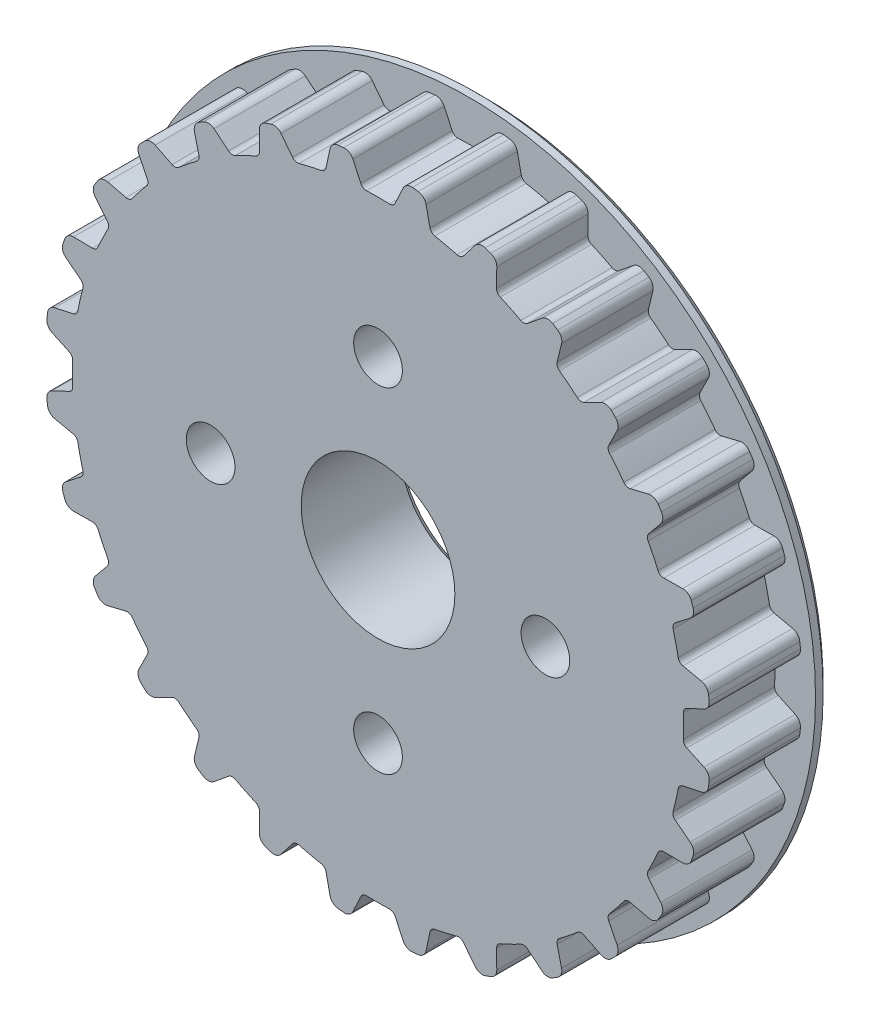
from build123d import *

# Parameters (mm, degrees)
EXTRUDE_1_DEPTH          = 6
PATTERN_CIRCULAR_1_COUNT = 28
SKETCH_4_R               = 22.75
EXTRUDE_2_DEPTH          = 1
SKETCH_2_R               = 5.05
CUT_EXTRUDE_1_DEPTH      = 33.926053514
SKETCH_3_R               = 1.6
CUT_EXTRUDE_2_DEPTH      = 33.926053514
CHAMFER_1_SIZE           = 2
CHAMFER_2_SIZE           = 0.5


with BuildPart() as part:
    # ｽｹｯﾁ1 → ﾎﾞｽ - 押し出し1 (new body)
    with BuildSketch(Plane.XY):
        with BuildLine():
            Line((-1.127467075, 20.291658591), (-1.651302325, 21.415026911))
            ThreePointArc((-1.651302325, 21.415026911), (-1.89927809, 21.683468492), (-2.256993094, 21.758253771))
            ThreePointArc((-2.256993094, 21.758253771), (-2.353130985, 21.748066571), (-2.449222915, 21.737454591))
            Line((-2.449222915, 21.737454591), (-0.559822381, 4.968561049))
            ThreePointArc((-0.559822381, 4.968561049), (0, -5), (0.559822381, 4.968561049))
            Line((0.559822381, 4.968561049), (2.449222915, 21.737454591))
            ThreePointArc((2.449222915, 21.737454591), (2.353130985, 21.748066571), (2.256993094, 21.758253771))
            ThreePointArc((2.256993094, 21.758253771), (1.89927809, 21.683468492), (1.651302325, 21.415026911))
            Line((1.651302325, 21.415026911), (1.127467075, 20.291658591))
            ThreePointArc((1.127467075, 20.291658591), (0.973523386, 20.119392809), (0.75, 20.060985145))
            ThreePointArc((0.75, 20.060985145), (0, 20.075), (-0.75, 20.060985145))
            ThreePointArc((-0.75, 20.060985145), (-0.973523386, 20.119392809), (-1.127467075, 20.291658591))
        make_face()
    extrude_1 = extrude(amount=EXTRUDE_1_DEPTH)

    # 円形ﾊﾟﾀｰﾝ1: ﾎﾞｽ - 押し出し1 ×28 about axis
    pattern_circular_1_axis = Axis((0, 0, 6), (0, 0, -1))
    for i in range(1, PATTERN_CIRCULAR_1_COUNT):
        add(extrude_1.rotate(pattern_circular_1_axis, i * 360 / PATTERN_CIRCULAR_1_COUNT))

    # ｽｹｯﾁ4 → ﾎﾞｽ - 押し出し2 (add)
    with BuildSketch(Plane(origin=(0, 0, 0), x_dir=(-1, 0, 0), z_dir=(0, 0, -1))):
        Circle(SKETCH_4_R)
    extrude(amount=EXTRUDE_2_DEPTH)

    # ｽｹｯﾁ2 → ｶｯﾄ - 押し出し1 (cut, through all)
    with BuildSketch(Plane.XY.offset(6)):
        Circle(SKETCH_2_R)
    extrude(amount=-CUT_EXTRUDE_1_DEPTH, mode=Mode.SUBTRACT)

    # ｽｹｯﾁ3 → ｶｯﾄ - 押し出し2 (cut, through all)
    with BuildSketch(Plane.XY.offset(6)):
        with Locations((0, 11)):
            Circle(SKETCH_3_R)
        with Locations((11, 0)):
            Circle(SKETCH_3_R)
        with Locations((0, -11)):
            Circle(SKETCH_3_R)
        with Locations((-11, 0)):
            Circle(SKETCH_3_R)
    extrude(amount=-CUT_EXTRUDE_2_DEPTH, mode=Mode.SUBTRACT)

    # 面取り1
    chamfer_1_edges = [part.edges().sort_by_distance(p)[0] for p in [
        (-12.6, 0, -1),
        (-1.6, 11, -1),
        (-1.6, -11, -1),
        (9.4, 0, -1),
    ]]
    chamfer(chamfer_1_edges, length=CHAMFER_1_SIZE)

    # 面取り2
    chamfer_2_edges = [part.edges().sort_by_distance(p)[0] for p in [
        (-5.05, 0, -1),
        (22.75, 0, -1),
    ]]
    chamfer(chamfer_2_edges, length=CHAMFER_2_SIZE)


solid = part.part
